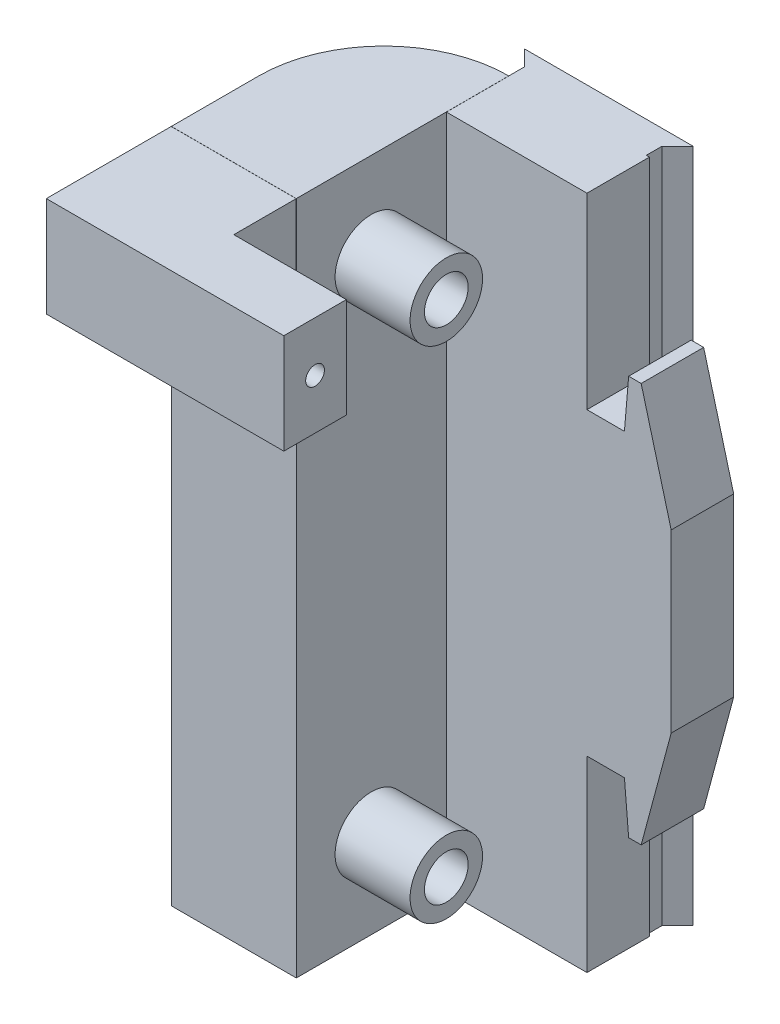
from build123d import *

# Parameters (mm, degrees)
SKETCH1_W           = 12
SKETCH1_H           = 54
BOSS_EXTRUDE1_DEPTH = 10
SKETCH2_R           = 2.9
BOSS_EXTRUDE2_DEPTH = 18
SKETCH3_W           = 12
SKETCH3_H           = 54
BOSS_EXTRUDE3_DEPTH = 10
SKETCH4_R           = 1.75
CUT_EXTRUDE1_DEPTH  = 50
SKETCH5_W           = 38
SKETCH5_H           = 54
BOSS_EXTRUDE4_DEPTH = 5
FILLET1_R           = 10
SKETCH6_W           = 6
SKETCH6_H           = 54
CUT_EXTRUDE2_DEPTH  = 15
SKETCH7_W           = 0.01
SKETCH7_H           = 54
CUT_EXTRUDE3_DEPTH  = 12.5
BOSS_EXTRUDE5_DEPTH = 8
SKETCH9_W           = 38
SKETCH9_H           = 0.01
CUT_EXTRUDE4_DEPTH  = 50
SKETCH10_W          = 11
SKETCH10_H          = 54
BOSS_EXTRUDE6_DEPTH = 2.5
BOSS_EXTRUDE7_DEPTH = 54
CUT_EXTRUDE5_DEPTH  = 5
SKETCH14_W          = 32.887251504
SKETCH14_H          = 59.683223859
CUT_EXTRUDE6_DEPTH  = 22
SKETCH15_R          = 0.75
CUT_EXTRUDE7_DEPTH  = 5


with BuildPart() as part:
    # Sketch1 → Boss-Extrude1 (new body)
    with BuildSketch(Plane(origin=(0, 0, 0), x_dir=(0, 0, -1), z_dir=(1, 0, 0))):
        with Locations((6, 27)):
            Rectangle(SKETCH1_W, SKETCH1_H)
    extrude(amount=BOSS_EXTRUDE1_DEPTH)

    # Sketch2 → Boss-Extrude2 (add)
    with BuildSketch(Plane.ZY):
        with Locations((-6, 47)):
            Circle(SKETCH2_R)
        with Locations((-6, 7)):
            Circle(SKETCH2_R)
    extrude(amount=BOSS_EXTRUDE2_DEPTH)

    # Sketch3 → Boss-Extrude3 (add)
    with BuildSketch(Plane.ZY.offset(18)):
        with Locations((-6, 27)):
            Rectangle(SKETCH3_W, SKETCH3_H)
    extrude(amount=BOSS_EXTRUDE3_DEPTH)

    # Sketch4 → Cut-Extrude1 (cut)
    with BuildSketch(Plane(origin=(10, 0, 0), x_dir=(0, 0, -1), z_dir=(1, 0, 0))):
        with Locations((6, 47)):
            Circle(SKETCH4_R)
        with Locations((6, 7)):
            Circle(SKETCH4_R)
    extrude(amount=-CUT_EXTRUDE1_DEPTH, mode=Mode.SUBTRACT)

    # Sketch5 → Boss-Extrude4 (add)
    with BuildSketch(Plane(origin=(0, 0, -12), x_dir=(-1, 0, 0), z_dir=(0, 0, -1))):
        with Locations((9, 27)):
            Rectangle(SKETCH5_W, SKETCH5_H)
    extrude(amount=BOSS_EXTRUDE4_DEPTH)

    # Fillet1
    # the kernel refuses this fillet: 10 mm, written as the material it takes off along each edge
    with BuildSketch(Plane(origin=(10, -25, -17), x_dir=(-1, 0, 0), z_dir=(0, 1, 0))) as fillet1_piece_1:
        with BuildLine():
            CenterArc((FILLET1_R, FILLET1_R), FILLET1_R, 180, 90)
            Line((0, FILLET1_R), (0, 0))
            Line((0, 0), (FILLET1_R, 0))
        make_face()
    extrude(amount=104, mode=Mode.SUBTRACT)
    with BuildSketch(Plane(origin=(-28, 79, -17), x_dir=(0, 0, 1), z_dir=(0, -1, 0))) as fillet1_piece_2:
        with BuildLine():
            CenterArc((FILLET1_R, -FILLET1_R), FILLET1_R, 90, 90)
            Line((0, -FILLET1_R), (0, 0))
            Line((0, 0), (FILLET1_R, 0))
        make_face()
    extrude(amount=104, mode=Mode.SUBTRACT)

    # Sketch6 → Cut-Extrude2 (cut)
    with BuildSketch(Plane.XY.offset(-12)):
        with Locations((-9, 27)):
            Rectangle(SKETCH6_W, SKETCH6_H)
    extrude(amount=CUT_EXTRUDE2_DEPTH, mode=Mode.SUBTRACT)

    # Sketch7 → Cut-Extrude3 (cut)
    with BuildSketch(Plane.XY.offset(-12)):
        with Locations((-17.995, 27)):
            Rectangle(SKETCH7_W, SKETCH7_H)
        with Locations((-0.005, 27)):
            Rectangle(SKETCH7_W, SKETCH7_H)
    extrude(amount=-CUT_EXTRUDE3_DEPTH, mode=Mode.SUBTRACT)


with BuildPart() as cut_extrude3_piece_1:
    # of the separate pieces the step leaves, piece 1, a body of its own (cut_extrude3_pieces)
    add(part.part.solids().sort_by_distance((-18, 0, 0))[0])



with BuildPart() as cut_extrude3_piece_2:
    # of the separate pieces the step leaves, piece 2, a body of its own (cut_extrude3_pieces)
    add(part.part.solids().sort_by_distance((0, 0, -17))[0])


with BuildPart() as cut_extrude3_piece_3:
    # of the separate pieces the step leaves, piece 3, a body of its own (cut_extrude3_pieces)
    add(part.part.solids().sort_by_distance((-17.99, 0, -12))[0])



with BuildPart() as cut_extrude3_piece_1_1:
    add(cut_extrude3_piece_1.part)

    add(cut_extrude3_piece_2.part)  # Boss-Extrude5 merges Cut-Extrude3 piece 2
    # Sketch8 → Boss-Extrude5 (add)
    with BuildSketch(Plane(origin=(0, 54, 0), x_dir=(1, 0, 0), z_dir=(0, 1, 0))):
        Polygon((-18, 0), (-18, -5), (0, -5), (0, 0), (10, 0), (10, -10), (-28, -10), (-28, 0), align=None)
    extrude(amount=-BOSS_EXTRUDE5_DEPTH)

    # Sketch9 → Cut-Extrude4 (cut)
    with BuildSketch(Plane.XZ.offset(-46)):
        with Locations((-9, 0.005)):
            Rectangle(SKETCH9_W, SKETCH9_H)
    extrude(amount=-CUT_EXTRUDE4_DEPTH, mode=Mode.SUBTRACT)


with BuildPart() as cut_extrude4_piece_1:
    # of the separate pieces the step leaves, piece 1, a body of its own (cut_extrude4_pieces)
    add(cut_extrude3_piece_1_1.part.solids().sort_by_distance((0, 0, -17))[0])


with BuildPart() as cut_extrude4_piece_2:
    # of the separate pieces the step leaves, piece 2, a body of its own (cut_extrude4_pieces)
    add(cut_extrude3_piece_1_1.part.solids().sort_by_distance((-18, 0, 0))[0])


with BuildPart() as cut_extrude4_piece_3:
    # of the separate pieces the step leaves, piece 3, a body of its own (cut_extrude4_pieces)
    add(cut_extrude3_piece_1_1.part.solids().sort_by_distance((0, 54, 0.01))[0])


with BuildPart() as cut_extrude3_piece_3_1:
    add(cut_extrude3_piece_3.part)

    add(cut_extrude4_piece_2.part)  # Boss-Extrude6 merges Cut-Extrude4 piece 2
    # Sketch10 → Boss-Extrude6 (add)
    with BuildSketch(Plane(origin=(0, 0, -17), x_dir=(-1, 0, 0), z_dir=(0, 0, -1))):
        with Locations((12.5, 27)):
            Rectangle(SKETCH10_W, SKETCH10_H)
    extrude(amount=BOSS_EXTRUDE6_DEPTH)

    # Sketch11 → Boss-Extrude7 (add)
    with BuildSketch(Plane(origin=(0, 54, 0), x_dir=(1, 0, 0), z_dir=(0, 1, 0))):
        Polygon((-18, 18.25), (-19.25, 19.5), (-18, 19.5), align=None)
        Polygon((-7, 19.5), (-7, 18.25), (-5.75, 19.5), align=None)
    extrude(amount=-BOSS_EXTRUDE7_DEPTH)


with BuildPart() as cut_extrude5_tool:
    # Sketch13 → Cut-Extrude5 (new body)
    with BuildSketch(Plane(origin=(0, 0, -17), x_dir=(-1, 0, 0), z_dir=(0, 0, -1))):
        Polygon((0, 34), (0.01, 54), (5.75, 54), (5.75, 57.531607605), (-24.050626329, 57.531607605), (-24.050626329, -8.302169783), (5.75, -8.302169783), (5.75, 0), (0.01, 0), (0, 20), align=None)
        Polygon((5.75, 54), (0.01, 54), (0, 34), (2.412537726, 42.985739481), (3.412537726, 42.985739481), (3.75, 39), (4.75, 39), (5.75, 39), (6.75, 39), (6.75, 54), align=None)
        Polygon((2.412537726, 11.014260519), (0, 20), (0.01, 0), (5.75, 0), (6.75, 0), (6.75, 15), (5.75, 15), (4.75, 15), (3.75, 15), (3.412537726, 11.014260519), align=None)
    extrude(amount=-CUT_EXTRUDE5_DEPTH)


with BuildPart() as cut_extrude3_piece_3_2:
    add(cut_extrude3_piece_3_1.part)

    # Cut-Extrude5: cut by cut_extrude5_tool
    add(cut_extrude5_tool.part, mode=Mode.SUBTRACT)


with BuildPart() as cut_extrude4_piece_1_1:
    add(cut_extrude4_piece_1.part)

    # Cut-Extrude5: cut by cut_extrude5_tool
    add(cut_extrude5_tool.part, mode=Mode.SUBTRACT)


with BuildPart() as cut_extrude6_tool:
    # Sketch14 → Cut-Extrude6 (new body)
    with BuildSketch(Plane.XY.offset(10)):
        with Locations((7.443625752, 24.15838807)):
            Rectangle(SKETCH14_W, SKETCH14_H)
    extrude(amount=-CUT_EXTRUDE6_DEPTH)


with BuildPart() as cut_extrude4_piece_1_2:
    add(cut_extrude4_piece_1_1.part)

    # Cut-Extrude6: cut by cut_extrude6_tool
    add(cut_extrude6_tool.part, mode=Mode.SUBTRACT)


with BuildPart() as cut_extrude4_piece_3_1:
    add(cut_extrude4_piece_3.part)

    # Cut-Extrude6: cut by cut_extrude6_tool
    add(cut_extrude6_tool.part, mode=Mode.SUBTRACT)

    # Sketch15 → Cut-Extrude7 (cut)
    with BuildSketch(Plane(origin=(-9, 0, 0), x_dir=(0, 0, -1), z_dir=(1, 0, 0))):
        with Locations((-7.5, 50)):
            Circle(SKETCH15_R)
    extrude(amount=-CUT_EXTRUDE7_DEPTH, mode=Mode.SUBTRACT)


solid = Compound([cut_extrude3_piece_3_2.part, cut_extrude4_piece_3_1.part])
